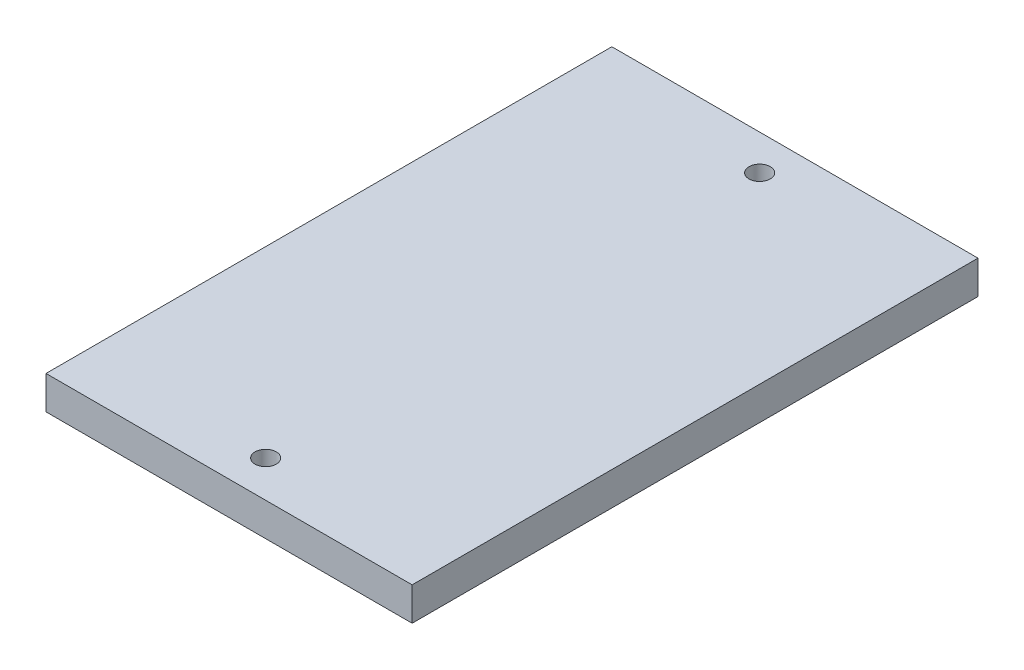
from build123d import *

# Parameters (mm, degrees)
SKETCH1_W           = 55
SKETCH1_H           = 85
SKETCH1_R           = 1.6
BOSS_EXTRUDE1_DEPTH = 5


with BuildPart() as part:
    # Sketch1 → Boss-Extrude1 (new body)
    with BuildSketch(Plane(origin=(0, 0, 0), x_dir=(1, 0, 0), z_dir=(0, 1, 0))):
        Rectangle(SKETCH1_W, SKETCH1_H)
        with Locations((0, -37)):
            Circle(SKETCH1_R, mode=Mode.SUBTRACT)
        with Locations((0, 37.2)):
            Circle(SKETCH1_R, mode=Mode.SUBTRACT)
    extrude(amount=BOSS_EXTRUDE1_DEPTH)


solid = part.part
